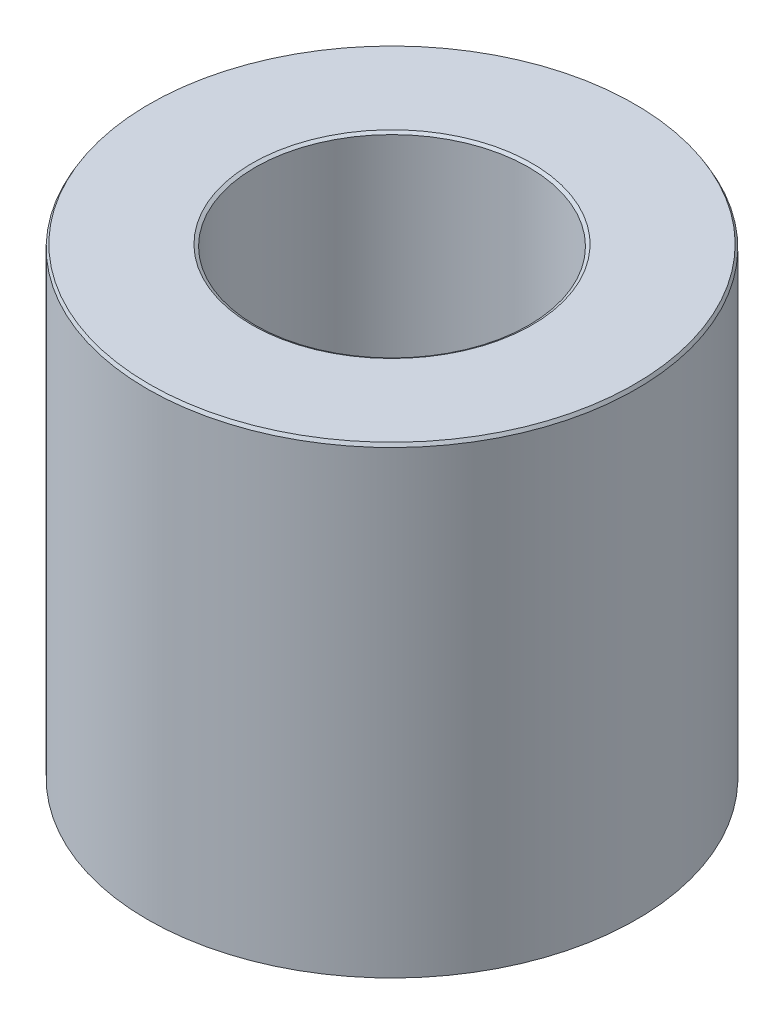
from build123d import *
from OCP.BRepFilletAPI import BRepFilletAPI_MakeChamfer

# Parameters (mm, degrees)
SKETCH1_R           = 57.5
BOSS_EXTRUDE1_DEPTH = 109.23153718
SKETCH2_R           = 32.169759576
CUT_EXTRUDE1_DEPTH  = 137.176461676
CHAMFER1_SIZE       = 0.765139488
CHAMFER1_SIZE2      = 0.441753489


with BuildPart() as part:
    # Sketch1 → Boss-Extrude1 (new body)
    with BuildSketch(Plane(origin=(0, 0, 0), x_dir=(1, 0, 0), z_dir=(0, 1, 0))):
        Circle(SKETCH1_R)
    extrude(amount=BOSS_EXTRUDE1_DEPTH)

    # Sketch2 → Cut-Extrude1 (cut, through all)
    with BuildSketch(Plane(origin=(0, 0, 0), x_dir=(1, 0, 0), z_dir=(0, 1, 0))):
        Circle(SKETCH2_R)
    extrude(amount=CUT_EXTRUDE1_DEPTH, mode=Mode.SUBTRACT)

    # Chamfer1: one chamfer whose edges measure the first distance from different faces: ONE call of the kernel's chamfer builder (chamfer() names one face for all edges)
    chamfer1_edges_1 = [part.edges().sort_by_distance(p)[0] for p in [
        (-32.169759576, 109.23153718, 0),
    ]]
    chamfer1_side_1 = [part.faces().sort_by_distance(p)[0] for p in [
        (-55.873654403, 109.23153718, 0),
    ]]
    chamfer1_edges_2 = [part.edges().sort_by_distance(p)[0] for p in [
        (-32.169759576, 0, 0),
    ]]
    chamfer1_side_2 = [part.faces().sort_by_distance(p)[0] for p in [
        (-32.169759576, 54.61576859, 0),
    ]]
    chamfer1_edges_3 = [part.edges().sort_by_distance(p)[0] for p in [
        (-57.5, 0, 0),
    ]]
    chamfer1_side_3 = [part.faces().sort_by_distance(p)[0] for p in [
        (-55.873654403, 0, 0),
    ]]
    chamfer1_edges_4 = [part.edges().sort_by_distance(p)[0] for p in [
        (-57.5, 109.23153718, 0),
    ]]
    chamfer1_side_4 = [part.faces().sort_by_distance(p)[0] for p in [
        (-57.5, 54.61576859, 0),
    ]]
    chamfer1 = BRepFilletAPI_MakeChamfer(part.part.solid().wrapped)
    for e in chamfer1_edges_1:
        chamfer1.Add(CHAMFER1_SIZE, CHAMFER1_SIZE2, e.wrapped, chamfer1_side_1[0].wrapped)  # the first distance lies on this face
    for e in chamfer1_edges_2:
        chamfer1.Add(CHAMFER1_SIZE, CHAMFER1_SIZE2, e.wrapped, chamfer1_side_2[0].wrapped)  # the first distance lies on this face
    for e in chamfer1_edges_3:
        chamfer1.Add(CHAMFER1_SIZE, CHAMFER1_SIZE2, e.wrapped, chamfer1_side_3[0].wrapped)  # the first distance lies on this face
    for e in chamfer1_edges_4:
        chamfer1.Add(CHAMFER1_SIZE, CHAMFER1_SIZE2, e.wrapped, chamfer1_side_4[0].wrapped)  # the first distance lies on this face
    add(Compound.cast(chamfer1.Shape()), mode=Mode.REPLACE)


solid = part.part
